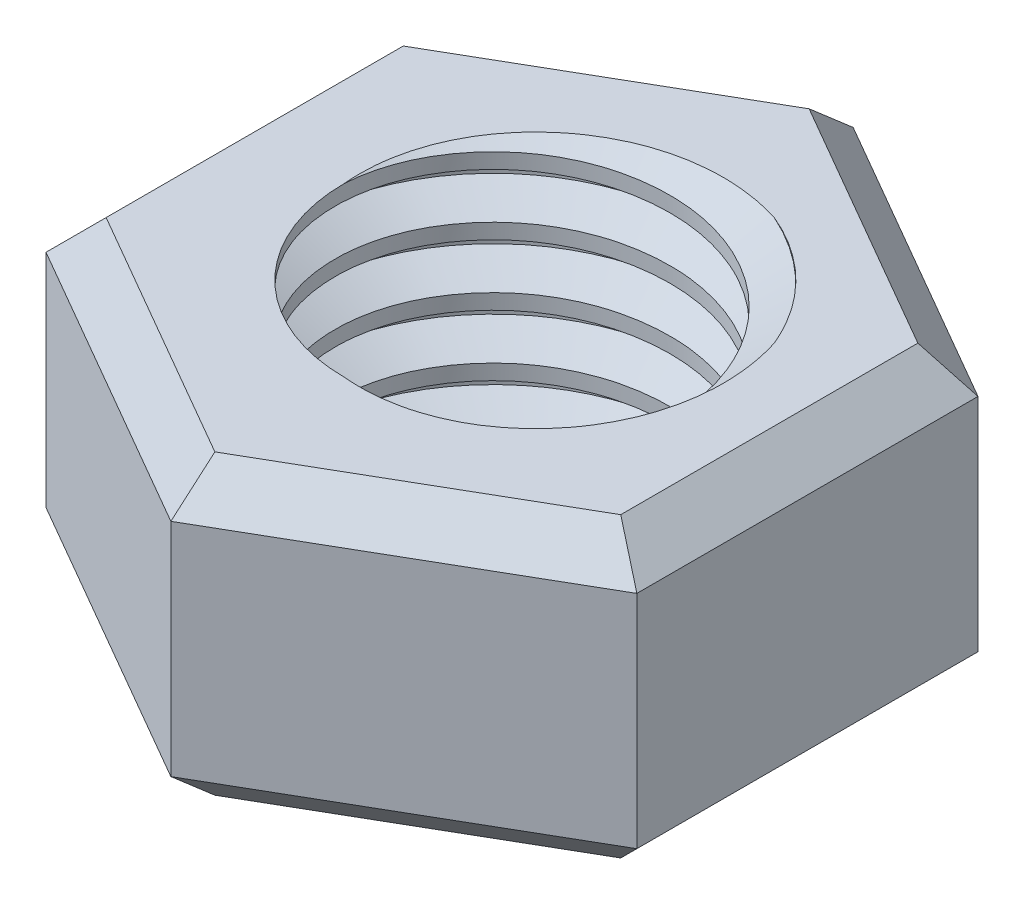
from build123d import *

# Parameters (mm, degrees)
SKETCH1_R           = 2.2
BOSS_EXTRUDE1_DEPTH = 3.9
THREAD1_PITCH       = 0.8
CHAMFER1_SIZE       = 0.5


with BuildPart() as part:
    # Sketch1 → Boss-Extrude1 (new body)
    with BuildSketch(Plane(origin=(0, 0, 0), x_dir=(1, 0, 0), z_dir=(0, 1, 0))):
        Polygon((0, -4.474464586), (3.875, -2.237232293), (3.875, 2.237232293), (0, 4.474464586), (-3.875, 2.237232293), (-3.875, -2.237232293), align=None)
        with Locations(Location((0, 0, 0), (0, 0, 270))):
            Circle(SKETCH1_R, mode=Mode.SUBTRACT)
    extrude(amount=BOSS_EXTRUDE1_DEPTH)

    # Thread1: the profile of Thread Profile1 profile screwed along a right-hand helix of 5.625 turns, 8 arcs to a turn; built about Z, then put on its axis
    thread1_z = Axis((0, 0, 0), (0, 0, 1))
    thread1_corners = [(2.1997, 0, -0.000173205), (2.6330127, 0, 0.249999999), (2.6330127, 0, 0.349999999), (2.1997, 0, 0.600173203)]
    with BuildLine(mode=Mode.PRIVATE) as thread1_profile:
        Line(thread1_corners[0], thread1_corners[1])
        Line(thread1_corners[1], thread1_corners[2])
        Line(thread1_corners[2], thread1_corners[3])
        Line(thread1_corners[3], thread1_corners[0])
    thread1_cap = Face(thread1_profile.wire())
    thread1_turn_angles = [0, 22.5, 45, 67.5, 90, 112.5, 135, 157.5, 180, 202.5, 225, 247.5, 270, 292.5, 315, 337.5, 360]
    thread1_turn_weights = [1, 0.9238795325112867, 1, 0.9238795325112867, 1, 0.9238795325112867, 1, 0.9238795325112867, 1, 0.9238795325112867, 1, 0.9238795325112867, 1, 0.9238795325112867, 1, 0.9238795325112867, 1]
    thread1_turn_rails = [Edge.make_bspline([Vector(p[0], p[1], 0).rotate(thread1_z, thread1_turn_angles[k]) / thread1_turn_weights[k] + Vector(0, 0, p[2] + THREAD1_PITCH * thread1_turn_angles[k] / 360) for k in range(17)], [0, 0, 0, 1, 1, 2, 2, 3, 3, 4, 4, 5, 5, 6, 6, 7, 7, 8, 8, 8], 2, thread1_turn_weights) for p in thread1_corners]
    thread1_turn_sides = [Face.make_surface_from_curves(thread1_turn_rails[p[0]], thread1_turn_rails[p[1]]) for p in [(0, 1), (1, 2), (2, 3), (3, 0)]]
    thread1_last_angles = [1800, 1822.5, 1845, 1867.5, 1890, 1912.5, 1935, 1957.5, 1980, 2002.5, 2025]
    thread1_last_weights = [1, 0.9238795325112867, 1, 0.9238795325112867, 1, 0.9238795325112867, 1, 0.9238795325112867, 1, 0.9238795325112867, 1]
    thread1_last_rails = [Edge.make_bspline([Vector(p[0], p[1], 0).rotate(thread1_z, thread1_last_angles[k]) / thread1_last_weights[k] + Vector(0, 0, p[2] + THREAD1_PITCH * thread1_last_angles[k] / 360) for k in range(11)], [0, 0, 0, 1, 1, 2, 2, 3, 3, 4, 4, 5, 5, 5], 2, thread1_last_weights) for p in thread1_corners]
    thread1_last_sides = [Face.make_surface_from_curves(thread1_last_rails[p[0]], thread1_last_rails[p[1]]) for p in [(0, 1), (1, 2), (2, 3), (3, 0)]]
    thread1 = Plane(origin=(0, 4.5, 0), x_dir=(-1, 0, 0), z_dir=(0, -1, 0)) * Solid(Shell([*[p.moved(Location((0, 0, THREAD1_PITCH * i))) for i in range(5) for p in thread1_turn_sides], *thread1_last_sides, thread1_cap, thread1_cap.rotate(thread1_z, 2025).moved(Location((0, 0, THREAD1_PITCH * 2025 / 360)))]))
    add(thread1, mode=Mode.SUBTRACT)

    # Chamfer1
    chamfer1_edges = [part.edges().sort_by_distance(p)[0] for p in [
        (3.875, 3.9, 0),
        (1.9375, 3.9, -3.35584844),
        (-1.9375, 3.9, -3.35584844),
        (-3.875, 3.9, 0),
        (-1.9375, 3.9, 3.35584844),
        (-3.875, 0, 0),
        (-1.9375, 0, -3.35584844),
        (1.9375, 0, -3.35584844),
        (1.9375, 3.9, 3.35584844),
        (3.875, 0, 0),
        (1.9375, 0, 3.35584844),
        (-1.9375, 0, 3.35584844),
    ]]
    chamfer(chamfer1_edges, length=CHAMFER1_SIZE)


solid = part.part
